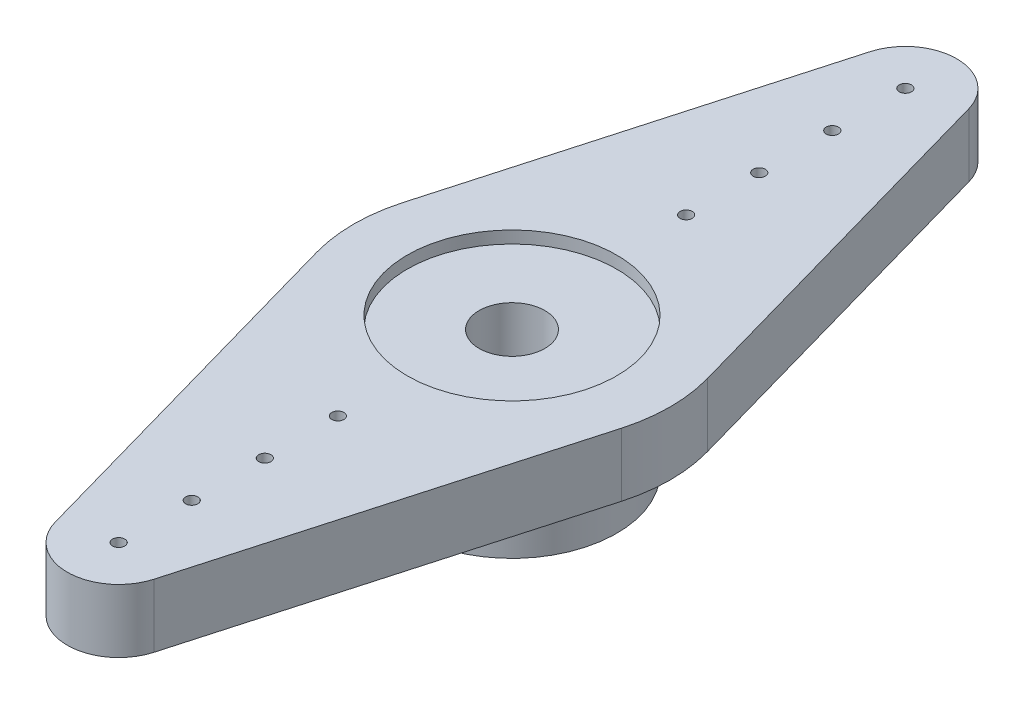
from build123d import *

# Parameters (mm, degrees)
SKETCH2_R                = 4.3
SKETCH2_R_2              = 2.75
BOSS_EXTRUDE1_DEPTH      = 3
SKETCH3_R                = 4.3
SKETCH3_R_2              = 1.35
BOSS_EXTRUDE2_DEPTH      = 2.1
BOSS_EXTRUDE3_DEPTH      = 0.5
BOSS_EXTRUDE3_DEPTH_BACK = 2.1
SKETCH4_R                = 4.3
SKETCH4_R_2              = 0.25


with BuildPart() as part:
    # Sketch2 → Boss-Extrude1 (new body)
    with BuildSketch(Plane(origin=(0, 0, 0), x_dir=(1, 0, 0), z_dir=(0, 1, 0))):
        Circle(SKETCH2_R)
        Circle(SKETCH2_R_2, mode=Mode.SUBTRACT)
    extrude(amount=BOSS_EXTRUDE1_DEPTH)



with BuildPart() as body_2:
    # Sketch3 → Boss-Extrude2 (new body)
    with BuildSketch(Plane(origin=(0, 3, 0), x_dir=(1, 0, 0), z_dir=(0, 1, 0))):
        Circle(SKETCH3_R)
        Circle(SKETCH3_R_2, mode=Mode.SUBTRACT)
    extrude(amount=BOSS_EXTRUDE2_DEPTH)


with BuildPart() as part_1:
    add(part.part)

    add(body_2.part)  # Boss-Extrude3 merges body 2
    # Sketch4 → Boss-Extrude3 (add, two sides: drawn at the far end of the back side and taken through both)
    with BuildSketch(Plane(origin=(0, 5.1, 0), x_dir=(1, 0, 0), z_dir=(0, 1, 0)).offset(-BOSS_EXTRUDE3_DEPTH_BACK)):
        with BuildLine():
            Line((-2.030550566, 16.72355418), (-6.25525056, 1.766873065))
            ThreePointArc((-6.25525056, 1.766873065), (-6.5, 0), (-6.25525056, -1.766873065))
            Line((-6.25525056, -1.766873065), (-2.030550566, -16.72355418))
            ThreePointArc((-2.030550566, -16.72355418), (0, -18.26), (2.030550566, -16.72355418))
            Line((2.030550566, -16.72355418), (6.25525056, -1.766873065))
            ThreePointArc((6.25525056, -1.766873065), (6.5, 0), (6.25525056, 1.766873065))
            Line((6.25525056, 1.766873065), (2.030550566, 16.72355418))
            ThreePointArc((2.030550566, 16.72355418), (0, 18.26), (-2.030550566, 16.72355418))
        make_face()
        Circle(SKETCH4_R, mode=Mode.SUBTRACT)
        with Locations((0, 16.15)):
            Circle(SKETCH4_R_2, mode=Mode.SUBTRACT)
        with Locations((0, 13.15)):
            Circle(SKETCH4_R_2, mode=Mode.SUBTRACT)
        with Locations((0, 10.15)):
            Circle(SKETCH4_R_2, mode=Mode.SUBTRACT)
        with Locations((0, 7.15)):
            Circle(SKETCH4_R_2, mode=Mode.SUBTRACT)
        with Locations((0, -7.15)):
            Circle(SKETCH4_R_2, mode=Mode.SUBTRACT)
        with Locations((0, -10.15)):
            Circle(SKETCH4_R_2, mode=Mode.SUBTRACT)
        with Locations((0, -13.15)):
            Circle(SKETCH4_R_2, mode=Mode.SUBTRACT)
        with Locations((0, -16.15)):
            Circle(SKETCH4_R_2, mode=Mode.SUBTRACT)
    extrude(amount=BOSS_EXTRUDE3_DEPTH + BOSS_EXTRUDE3_DEPTH_BACK)


solid = part_1.part
